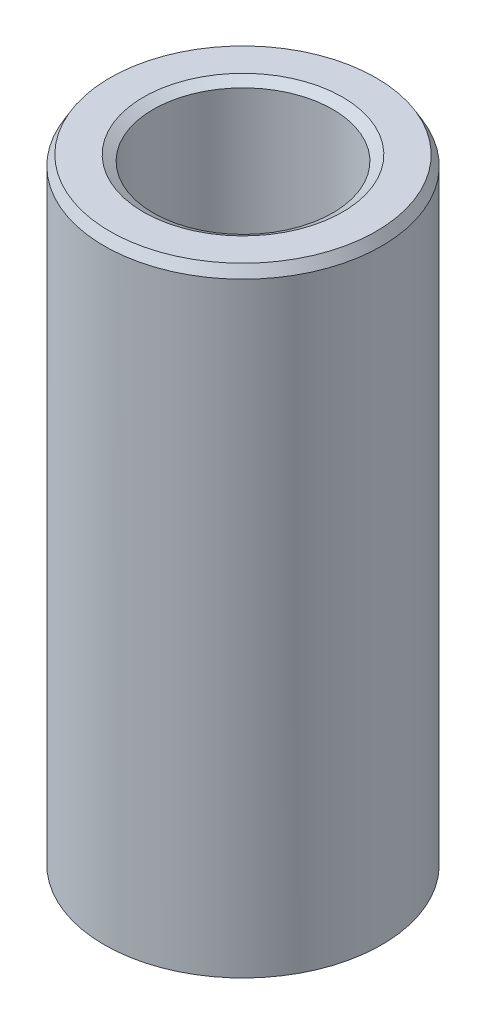
from build123d import *
from OCP.BRepFilletAPI import BRepFilletAPI_MakeChamfer

# Parameters (mm, degrees)
SKETCH1_R           = 10
BOSS_EXTRUDE1_DEPTH = 44.732475652
SKETCH2_R           = 6.470015046
CUT_EXTRUDE1_DEPTH  = 47.914756505
CHAMFER1_SIZE       = 0.708139601
CHAMFER1_SIZE2      = 0.408844589


with BuildPart() as part:
    # Sketch1 → Boss-Extrude1 (new body)
    with BuildSketch(Plane(origin=(0, 0, 0), x_dir=(1, 0, 0), z_dir=(0, 1, 0))):
        Circle(SKETCH1_R)
    extrude(amount=BOSS_EXTRUDE1_DEPTH)

    # Sketch2 → Cut-Extrude1 (cut, through all)
    with BuildSketch(Plane(origin=(0, 0, 0), x_dir=(1, 0, 0), z_dir=(0, 1, 0))):
        Circle(SKETCH2_R)
    extrude(amount=CUT_EXTRUDE1_DEPTH, mode=Mode.SUBTRACT)

    # Chamfer1: one chamfer whose edges measure the first distance from different faces: ONE call of the kernel's chamfer builder (chamfer() names one face for all edges)
    chamfer1_edges_1 = [part.edges().sort_by_distance(p)[0] for p in [
        (-6.470015046, 44.732475652, 0),
    ]]
    chamfer1_side_1 = [part.faces().sort_by_distance(p)[0] for p in [
        (-9.717157288, 44.732475652, 0),
    ]]
    chamfer1_edges_2 = [part.edges().sort_by_distance(p)[0] for p in [
        (-6.470015046, 0, 0),
    ]]
    chamfer1_side_2 = [part.faces().sort_by_distance(p)[0] for p in [
        (-6.470015046, 22.366237826, 0),
    ]]
    chamfer1_edges_3 = [part.edges().sort_by_distance(p)[0] for p in [
        (-10, 0, 0),
    ]]
    chamfer1_side_3 = [part.faces().sort_by_distance(p)[0] for p in [
        (-9.717157288, 0, 0),
    ]]
    chamfer1_edges_4 = [part.edges().sort_by_distance(p)[0] for p in [
        (-10, 44.732475652, 0),
    ]]
    chamfer1_side_4 = [part.faces().sort_by_distance(p)[0] for p in [
        (-10, 22.366237826, 0),
    ]]
    chamfer1 = BRepFilletAPI_MakeChamfer(part.part.solid().wrapped)
    for e in chamfer1_edges_1:
        chamfer1.Add(CHAMFER1_SIZE, CHAMFER1_SIZE2, e.wrapped, chamfer1_side_1[0].wrapped)  # the first distance lies on this face
    for e in chamfer1_edges_2:
        chamfer1.Add(CHAMFER1_SIZE, CHAMFER1_SIZE2, e.wrapped, chamfer1_side_2[0].wrapped)  # the first distance lies on this face
    for e in chamfer1_edges_3:
        chamfer1.Add(CHAMFER1_SIZE, CHAMFER1_SIZE2, e.wrapped, chamfer1_side_3[0].wrapped)  # the first distance lies on this face
    for e in chamfer1_edges_4:
        chamfer1.Add(CHAMFER1_SIZE, CHAMFER1_SIZE2, e.wrapped, chamfer1_side_4[0].wrapped)  # the first distance lies on this face
    add(Compound.cast(chamfer1.Shape()), mode=Mode.REPLACE)


solid = part.part
